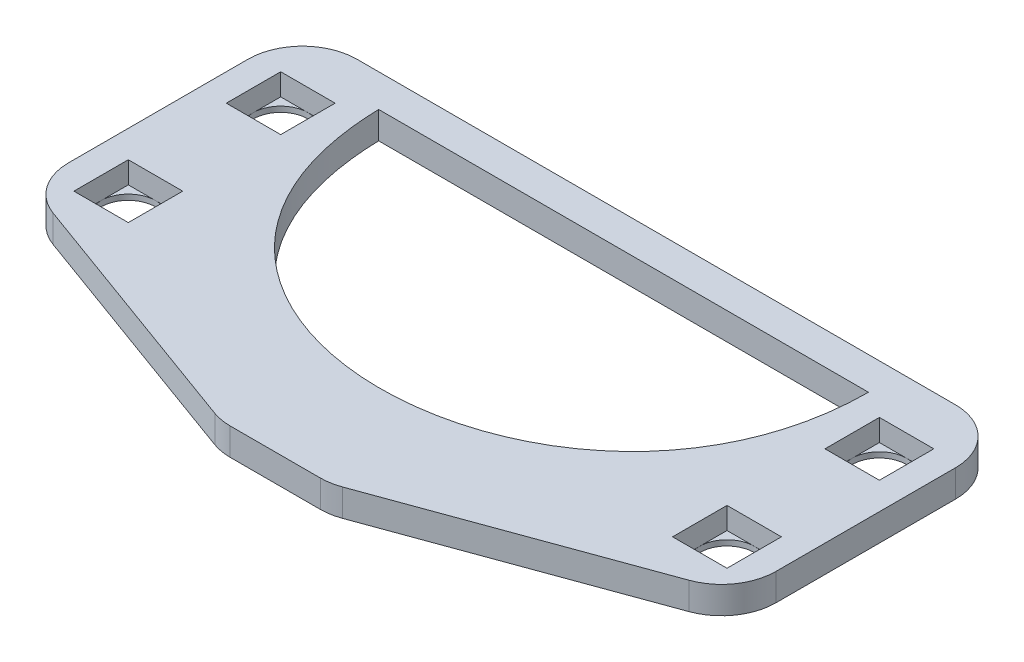
from build123d import *
from OCP.BRepFilletAPI import BRepFilletAPI_MakeChamfer

# Parameters (mm, degrees)
SKETCH1_W           = 65
SKETCH1_H           = 35
BOSS_EXTRUDE1_DEPTH = 2.5
SKETCH2_R           = 2.5
CUT_EXTRUDE1_DEPTH  = 74.866433513
CUT_EXTRUDE2_DEPTH  = 2
CHAMFER1_SIZE       = 10
CHAMFER1_SIZE2      = 27.474774195
FILLET1_R           = 5


with BuildPart() as part:
    # Sketch1 → Boss-Extrude1 (new body)
    with BuildSketch(Plane(origin=(0, 0, 0), x_dir=(1, 0, 0), z_dir=(0, 1, 0))):
        with Locations((32.5, 17.5)):
            Rectangle(SKETCH1_W, SKETCH1_H)
    extrude(amount=BOSS_EXTRUDE1_DEPTH)

    # Sketch2 → Cut-Extrude1 (cut, through all)
    with BuildSketch(Plane(origin=(0, 2.5, 0), x_dir=(1, 0, 0), z_dir=(0, 1, 0))):
        with BuildLine():
            Line((55, 32), (10, 32))
            add(Edge.make_bspline(
                [(55, 32), (54.840511117, 3.27873716), (10.724926058, 1.716849046), (10, 32)],
                knots=[0, 0, 0, 0, 1, 1, 1, 1], degree=3))
        make_face()
        with Locations((5, 28)):
            Circle(SKETCH2_R)
        with Locations((5, 14)):
            Circle(SKETCH2_R)
        with Locations((60, 14)):
            Circle(SKETCH2_R)
        with Locations((60, 28)):
            Circle(SKETCH2_R)
    extrude(amount=-CUT_EXTRUDE1_DEPTH, mode=Mode.SUBTRACT)

    # Sketch2<3> → Cut-Extrude2 (cut)
    with BuildSketch(Plane(origin=(0, 2.5, 0), x_dir=(1, 0, 0), z_dir=(0, 1, 0))):
        with BuildLine():
            Line((7.5, 28), (7.5, 30.5))
            Line((7.5, 30.5), (5, 30.5))
            ThreePointArc((5, 30.5), (6.767766953, 29.767766953), (7.5, 28))
        make_face()
        with BuildLine():
            ThreePointArc((2.5, 27.999999992), (3.232233044, 29.76776695), (5, 30.5))
            Line((5, 30.5), (2.5, 30.5))
            Line((2.5, 30.5), (2.5, 27.999999992))
        make_face()
        with BuildLine():
            Line((7.5, 25.5), (7.5, 28))
            ThreePointArc((7.5, 28), (6.767766953, 26.232233047), (5, 25.5))
            Line((5, 25.5), (7.5, 25.5))
        make_face()
        with BuildLine():
            ThreePointArc((5, 25.5), (3.23223305, 26.232233044), (2.5, 27.999999992))
            Line((2.5, 27.999999992), (2.5, 25.5))
            Line((2.5, 25.5), (5, 25.5))
        make_face()
        with BuildLine():
            Line((7.5, 14), (7.5, 16.5))
            Line((7.5, 16.5), (5, 16.5))
            ThreePointArc((5, 16.5), (6.767766953, 15.767766953), (7.5, 14))
        make_face()
        with BuildLine():
            ThreePointArc((2.5, 14), (3.232233047, 15.767766953), (5, 16.5))
            Line((5, 16.5), (2.5, 16.5))
            Line((2.5, 16.5), (2.5, 14))
        make_face()
        with BuildLine():
            Line((7.5, 11.5), (7.5, 14))
            ThreePointArc((7.5, 14), (6.767766953, 12.232233047), (5, 11.5))
            Line((5, 11.5), (7.5, 11.5))
        make_face()
        with BuildLine():
            ThreePointArc((5, 11.5), (3.232233047, 12.232233047), (2.5, 14))
            Line((2.5, 14), (2.5, 11.5))
            Line((2.5, 11.5), (5, 11.5))
        make_face()
        with BuildLine():
            Line((60, 16.5), (57.5, 16.5))
            Line((57.5, 16.5), (57.5, 14))
            ThreePointArc((57.5, 14), (58.232233047, 15.767766953), (60, 16.5))
        make_face()
        with BuildLine():
            Line((62.5, 16.5), (60, 16.5))
            ThreePointArc((60, 16.5), (61.767766953, 15.767766953), (62.5, 14))
            Line((62.5, 14), (62.5, 16.5))
        make_face()
        with BuildLine():
            ThreePointArc((60, 11.5), (58.232233047, 12.232233047), (57.5, 14))
            Line((57.5, 14), (57.5, 11.5))
            Line((57.5, 11.5), (60, 11.5))
        make_face()
        with BuildLine():
            Line((62.5, 11.5), (62.5, 14))
            ThreePointArc((62.5, 14), (61.767766953, 12.232233047), (60, 11.5))
            Line((60, 11.5), (62.5, 11.5))
        make_face()
        with BuildLine():
            Line((60, 30.5), (57.5, 30.5))
            Line((57.5, 30.5), (57.5, 28))
            ThreePointArc((57.5, 28), (58.232233047, 29.767766953), (60, 30.5))
        make_face()
        with BuildLine():
            Line((62.5, 30.5), (60, 30.5))
            ThreePointArc((60, 30.5), (61.767766953, 29.767766953), (62.5, 28))
            Line((62.5, 28), (62.5, 30.5))
        make_face()
        with BuildLine():
            ThreePointArc((60, 25.5), (58.232233047, 26.232233047), (57.5, 28))
            Line((57.5, 28), (57.5, 25.5))
            Line((57.5, 25.5), (60, 25.5))
        make_face()
        with BuildLine():
            Line((62.5, 25.5), (62.5, 28))
            ThreePointArc((62.5, 28), (61.767766953, 26.232233047), (60, 25.5))
            Line((60, 25.5), (62.5, 25.5))
        make_face()
    extrude(amount=-CUT_EXTRUDE2_DEPTH, mode=Mode.SUBTRACT)

    # Chamfer1: one chamfer whose edges measure the first distance from different faces: ONE call of the kernel's chamfer builder (chamfer() names one face for all edges)
    chamfer1_edges_1 = [part.edges().sort_by_distance(p)[0] for p in [
        (65, 1.25, 0),
    ]]
    chamfer1_side_1 = [part.faces().sort_by_distance(p)[0] for p in [
        (65, 1.25, -17.5),
    ]]
    chamfer1_edges_2 = [part.edges().sort_by_distance(p)[0] for p in [
        (0, 1.25, 0),
    ]]
    chamfer1_side_2 = [part.faces().sort_by_distance(p)[0] for p in [
        (0, 1.25, -17.5),
    ]]
    chamfer1 = BRepFilletAPI_MakeChamfer(part.part.solid().wrapped)
    for e in chamfer1_edges_1:
        chamfer1.Add(CHAMFER1_SIZE, CHAMFER1_SIZE2, e.wrapped, chamfer1_side_1[0].wrapped)  # the first distance lies on this face
    for e in chamfer1_edges_2:
        chamfer1.Add(CHAMFER1_SIZE, CHAMFER1_SIZE2, e.wrapped, chamfer1_side_2[0].wrapped)  # the first distance lies on this face
    add(Compound.cast(chamfer1.Shape()), mode=Mode.REPLACE)

    # Fillet1
    fillet1_edges = [part.edges().sort_by_distance(p)[0] for p in [
        (27.474774195, 1.25, 0),
        (37.525225805, 1.25, 0),
        (65, 1.25, -10),
        (65, 1.25, -35),
        (0, 1.25, -35),
        (0, 1.25, -10),
    ]]
    fillet(fillet1_edges, radius=FILLET1_R)


solid = part.part
